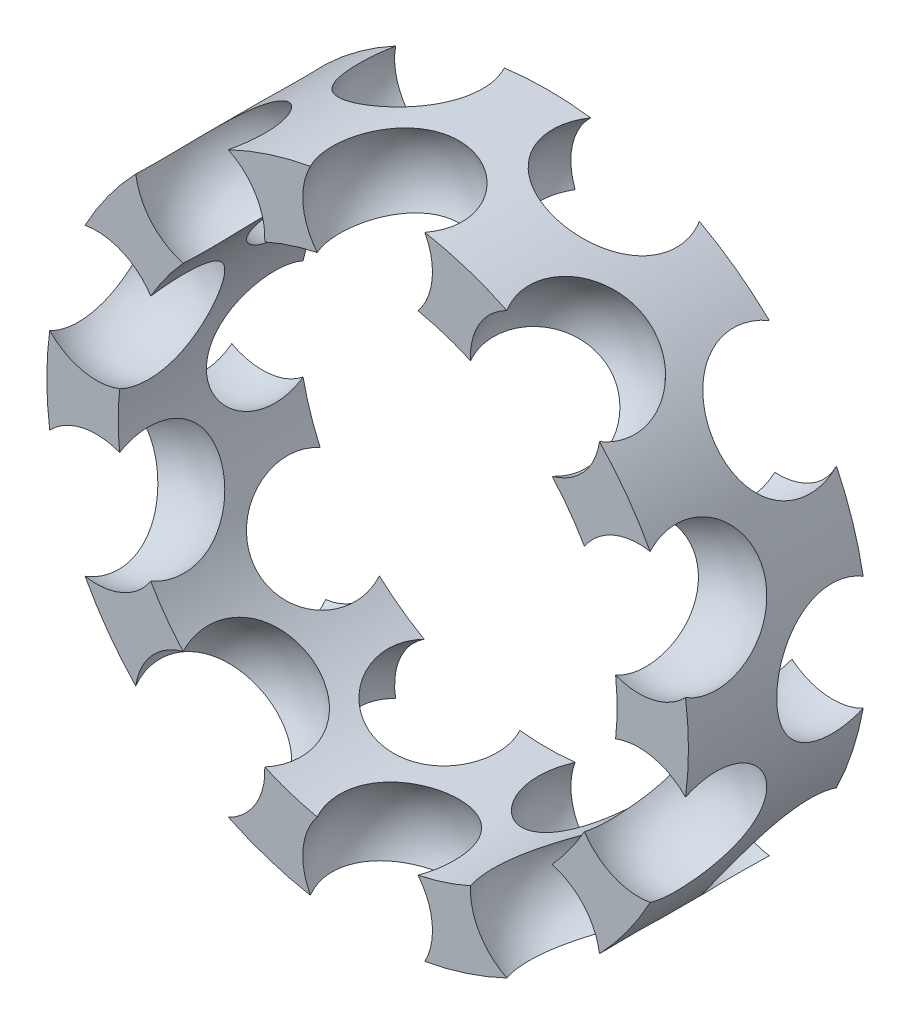
from build123d import *

# Parameters (mm, degrees)
SKETCH_1_W               = 4.5
SKETCH_1_H               = 1.625
PATTERN_CIRCULAR_1_COUNT = 10
PATTERN_CIRCULAR_2_COUNT = 10
CUT_EXTRUDE_START        = -0.2
SKETCH_4_R               = 7.3125
CUT_EXTRUDE_1_DEPTH      = 0.2


with BuildPart() as part:
    # Эскиз1 → Повернуть1 (revolve)
    with BuildSketch(Plane(origin=(0, 0, 0), x_dir=(0, 0, -1), z_dir=(1, 0, 0))):
        with Locations((2.25, 6.5)):
            Rectangle(SKETCH_1_W, SKETCH_1_H)
    revolve(axis=Axis((0, 0, 0), (0, 0, -1)))

    # Эскиз2 → Вырез-Повернуть1 (revolve, cut)
    with BuildSketch(Plane(origin=(0, 6.5, 0), x_dir=(1, 0, 0), z_dir=(0, 1, 0))):
        with BuildLine():
            Line((0, 2.5), (0, -0.75))
            ThreePointArc((0, -0.75), (1.625, 0.875), (0, 2.5))
        make_face()
    cut_revolve_1 = revolve(axis=Axis((0, 6.5, -2.5), (0, 0, 1)), mode=Mode.SUBTRACT)

    # Круговой массив1: Вырез-Повернуть1 ×10 about axis
    pattern_circular_1_axis = Axis((0, 0, 0), (0, 0, 1))
    for i in range(1, PATTERN_CIRCULAR_1_COUNT):
        add(cut_revolve_1.rotate(pattern_circular_1_axis, i * 360 / PATTERN_CIRCULAR_1_COUNT), mode=Mode.SUBTRACT)

    # Эскиз3 → Вырез-Повернуть2 (revolve, cut)
    with BuildSketch(Plane(origin=(-2.008610463, 6.181867356, 0), x_dir=(0, 0, 1), z_dir=(-0.3090169943749482, 0.9510565162951534, 0))):
        with BuildLine():
            Line((-5.245, 0), (-1.995, 0))
            ThreePointArc((-1.995, 0), (-3.62, 1.625), (-5.245, 0))
        make_face()
    cut_revolve_2 = revolve(axis=Axis((-2.008610463, 6.181867356, -5.245), (0, 0, 1)), mode=Mode.SUBTRACT)

    # Круговой массив2: Вырез-Повернуть2 ×10 about axis
    pattern_circular_2_axis = Axis((0, 0, 0), (0, 0, 1))
    for i in range(1, PATTERN_CIRCULAR_2_COUNT):
        add(cut_revolve_2.rotate(pattern_circular_2_axis, i * 360 / PATTERN_CIRCULAR_2_COUNT), mode=Mode.SUBTRACT)

    # Эскиз4 → Вырез-Вытянуть1 (cut)
    with BuildSketch(Plane.XY.offset(CUT_EXTRUDE_START)):
        Circle(SKETCH_4_R)
    cut_extrude_1 = extrude(amount=CUT_EXTRUDE_1_DEPTH, mode=Mode.SUBTRACT)

    # Зеркальное отражение1: Вырез-Вытянуть1 across plane
    add(cut_extrude_1.mirror(Plane.XY.offset(-2.25)), mode=Mode.SUBTRACT)


solid = part.part
